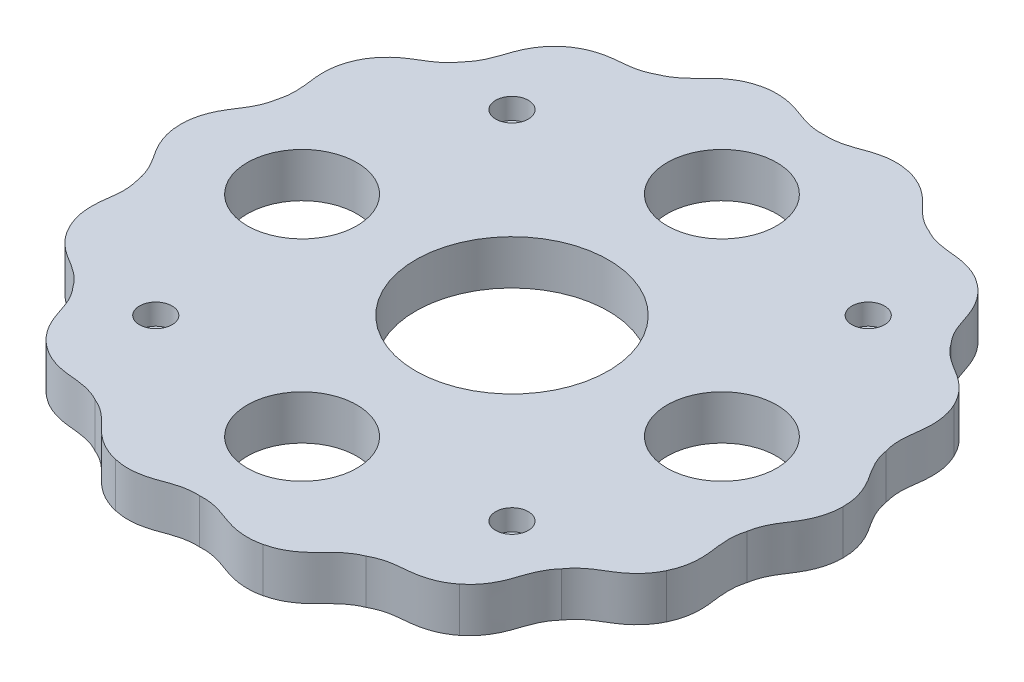
from build123d import *

# Parameters (mm, degrees)
BOSS_EXTRUDE3_DEPTH = 4.7625
SKETCH2_R           = 10.328125
SKETCH2_R_2         = 5.875
CUT_EXTRUDE1_DEPTH  = 4.7625
SKETCH2_4_R         = 1.75
CUT_EXTRUDE2_DEPTH  = 2.245833333


with BuildPart() as part:
    # Sketch1 → Boss-Extrude3 (new body)
    with BuildSketch(Plane(origin=(0, 0, 0), x_dir=(1, 0, 0), z_dir=(0, 1, 0))):
        with BuildLine():
            Line((35.500002326, 0.003735881), (35.500002326, 0))
            Line((35.500002326, 0), (35.500002326, -0.003735881))
            add(Edge.make_bspline(
                [(32.644810899, -7.45096506), (32.674793712, -7.260710929), (32.757965618, -6.873262555), (32.975088878, -6.197475635), (33.30681421, -5.487322542), (33.693887271, -4.83935734), (34.139372051, -4.165162167), (34.499748971, -3.6014921), (34.870711868, -2.889611748), (35.149566879, -2.192738575), (35.418263863, -1.23361479), (35.50061524, -0.495919336), (35.500002326, -0.003735881)],
                knots=[0.02301065, 0.02301065, 0.02301065, 0.02301065, 0.053541567, 0.084072485, 0.145134319, 0.206196153, 0.267257988, 0.389381656, 0.511505325, 0.633628994, 0.755752663, 1, 1, 1, 1], degree=3))
            add(Edge.make_bspline(
                [(31.986017844, -15.399507835), (32.200120458, -14.956331799), (32.445998494, -14.255960238), (32.62005909, -13.275236314), (32.671181344, -12.526384626), (32.645828632, -11.724047822), (32.565707523, -11.059836954), (32.456861927, -10.25911949), (32.389262714, -9.507378309), (32.398512397, -8.723622254), (32.496104055, -8.020553026), (32.589276306, -7.635387164), (32.644810899, -7.45096506)],
                knots=[0.02301065, 0.02301065, 0.02301065, 0.02301065, 0.267257988, 0.389381656, 0.511505325, 0.633628994, 0.755752663, 0.816814497, 0.877876331, 0.938938166, 0.969469083, 1, 1, 1, 1], degree=3))
            Line((31.986017844, -15.399507835), (31.984396906, -15.402873748))
            Line((31.984396906, -15.402873748), (31.982775968, -15.406239661))
            add(Edge.make_bspline(
                [(26.179105738, -20.877140171), (26.288667493, -20.718736177), (26.531710341, -20.405744191), (27.020544594, -19.891087467), (27.62754267, -19.395191866), (28.257425012, -18.979340099), (28.951315253, -18.565199839), (29.520570914, -18.213712342), (30.163670245, -17.733285076), (30.717271866, -17.226414698), (31.375507699, -16.478857279), (31.769777787, -15.849947564), (31.982775968, -15.406239661)],
                knots=[0.02301065, 0.02301065, 0.02301065, 0.02301065, 0.053541567, 0.084072485, 0.145134319, 0.206196153, 0.267257988, 0.389381656, 0.511505325, 0.633628994, 0.755752663, 1, 1, 1, 1], degree=3))
            add(Edge.make_bspline(
                [(22.136810246, -27.752690162), (22.521996911, -27.446297993), (23.047405198, -26.921967502), (23.62974854, -26.113887841), (24.00072267, -25.461376898), (24.326001557, -24.727496287), (24.542005228, -24.094299727), (24.791357022, -23.325651886), (25.05662051, -22.619026286), (25.405013194, -21.916899767), (25.797990545, -21.325799714), (26.049053047, -21.019203188), (26.179105738, -20.877140171)],
                knots=[0.02301065, 0.02301065, 0.02301065, 0.02301065, 0.267257988, 0.389381656, 0.511505325, 0.633628994, 0.755752663, 0.816814497, 0.877876331, 0.938938166, 0.969469083, 1, 1, 1, 1], degree=3))
            Line((22.136810246, -27.752690162), (22.133889416, -27.755019446))
            Line((22.133889416, -27.755019446), (22.130968587, -27.75734873))
            add(Edge.make_bspline(
                [(14.52830762, -30.168341629), (14.695748267, -30.073161626), (15.05052444, -29.89661793), (15.714250068, -29.645025478), (16.476297475, -29.461605575), (17.224233175, -29.360231784), (18.029095404, -29.288171996), (18.694481743, -29.218483478), (19.482343797, -29.064663811), (20.201044438, -28.848188121), (21.118447439, -28.460259983), (21.746546212, -28.06469929), (22.130968587, -27.75734873)],
                knots=[0.02301065, 0.02301065, 0.02301065, 0.02301065, 0.053541567, 0.084072485, 0.145134319, 0.206196153, 0.267257988, 0.389381656, 0.511505325, 0.633628994, 0.755752663, 1, 1, 1, 1], degree=3))
            add(Edge.make_bspline(
                [(7.903135888, -34.609111839), (8.383115662, -34.500188263), (9.083990645, -34.255748926), (9.959276491, -33.780363616), (10.576626521, -33.353431213), (11.188111536, -32.833360849), (11.657457809, -32.356590942), (12.215619812, -31.772252855), (12.761207314, -31.250698702), (13.379739556, -30.769266488), (13.990268616, -30.407210225), (14.349495361, -30.239908237), (14.52830762, -30.168341629)],
                knots=[0.02301065, 0.02301065, 0.02301065, 0.02301065, 0.267257988, 0.389381656, 0.511505325, 0.633628994, 0.755752663, 0.816814497, 0.877876331, 0.938938166, 0.969469083, 1, 1, 1, 1], degree=3))
            Line((7.903135888, -34.609111839), (7.899493673, -34.60994315))
            Line((7.899493673, -34.60994315), (7.895851458, -34.610774462))
            add(Edge.make_bspline(
                [(0, -33.484333037), (0.192155866, -33.471228592), (0.588397592, -33.466099831), (1.295555593, -33.527402621), (2.061719496, -33.692786976), (2.779570716, -33.925969485), (3.535992098, -34.210262493), (4.165721189, -34.43617562), (4.942300224, -34.639429423), (5.683752409, -34.756224087), (6.678619663, -34.804759157), (7.416144457, -34.72089313), (7.895851458, -34.610774462)],
                knots=[0.02301065, 0.02301065, 0.02301065, 0.02301065, 0.053541567, 0.084072485, 0.145134319, 0.206196153, 0.267257988, 0.389381656, 0.511505325, 0.633628994, 0.755752663, 1, 1, 1, 1], degree=3))
            add(Edge.make_bspline(
                [(-7.895851458, -34.610774462), (-7.416144457, -34.72089313), (-6.678619663, -34.804759157), (-5.683752409, -34.756224087), (-4.942300224, -34.639429423), (-4.165721189, -34.43617562), (-3.535992098, -34.210262493), (-2.779570716, -33.925969485), (-2.061719496, -33.692786976), (-1.295555593, -33.527402621), (-0.588397592, -33.466099831), (-0.192155866, -33.471228592), (0, -33.484333037)],
                knots=[0.02301065, 0.02301065, 0.02301065, 0.02301065, 0.267257988, 0.389381656, 0.511505325, 0.633628994, 0.755752663, 0.816814497, 0.877876331, 0.938938166, 0.969469083, 1, 1, 1, 1], degree=3))
            Line((-7.895851458, -34.610774462), (-7.899493673, -34.60994315))
            Line((-7.899493673, -34.60994315), (-7.903135888, -34.609111839))
            add(Edge.make_bspline(
                [(-14.52830762, -30.168341629), (-14.349495361, -30.239908237), (-13.990268616, -30.407210225), (-13.379739556, -30.769266488), (-12.761207314, -31.250698702), (-12.215619812, -31.772252855), (-11.657457809, -32.356590942), (-11.188111536, -32.833360849), (-10.576626521, -33.353431213), (-9.959276491, -33.780363616), (-9.083990645, -34.255748926), (-8.383115662, -34.500188263), (-7.903135888, -34.609111839)],
                knots=[0.02301065, 0.02301065, 0.02301065, 0.02301065, 0.053541567, 0.084072485, 0.145134319, 0.206196153, 0.267257988, 0.389381656, 0.511505325, 0.633628994, 0.755752663, 1, 1, 1, 1], degree=3))
            add(Edge.make_bspline(
                [(-22.130968587, -27.75734873), (-21.746546212, -28.06469929), (-21.118447439, -28.460259983), (-20.201044438, -28.848188121), (-19.482343797, -29.064663811), (-18.694481743, -29.218483478), (-18.029095404, -29.288171996), (-17.224233175, -29.360231784), (-16.476297475, -29.461605575), (-15.714250068, -29.645025478), (-15.05052444, -29.89661793), (-14.695748267, -30.073161626), (-14.52830762, -30.168341629)],
                knots=[0.02301065, 0.02301065, 0.02301065, 0.02301065, 0.267257988, 0.389381656, 0.511505325, 0.633628994, 0.755752663, 0.816814497, 0.877876331, 0.938938166, 0.969469083, 1, 1, 1, 1], degree=3))
            Line((-22.130968587, -27.75734873), (-22.133889416, -27.755019446))
            Line((-22.133889416, -27.755019446), (-22.136810246, -27.752690162))
            add(Edge.make_bspline(
                [(-26.179105738, -20.877140171), (-26.049053047, -21.019203188), (-25.797990545, -21.325799714), (-25.405013194, -21.916899767), (-25.05662051, -22.619026286), (-24.791357022, -23.325651886), (-24.542005228, -24.094299727), (-24.326001557, -24.727496287), (-24.00072267, -25.461376898), (-23.62974854, -26.113887841), (-23.047405198, -26.921967502), (-22.521996911, -27.446297993), (-22.136810246, -27.752690162)],
                knots=[0.02301065, 0.02301065, 0.02301065, 0.02301065, 0.053541567, 0.084072485, 0.145134319, 0.206196153, 0.267257988, 0.389381656, 0.511505325, 0.633628994, 0.755752663, 1, 1, 1, 1], degree=3))
            add(Edge.make_bspline(
                [(-31.982775968, -15.406239661), (-31.769777787, -15.849947564), (-31.375507698, -16.478857279), (-30.717271866, -17.226414698), (-30.163670245, -17.733285076), (-29.520570914, -18.213712342), (-28.951315253, -18.565199839), (-28.257425012, -18.979340099), (-27.62754267, -19.395191866), (-27.020544594, -19.891087467), (-26.531710341, -20.405744191), (-26.288667493, -20.718736177), (-26.179105738, -20.877140171)],
                knots=[0.02301065, 0.02301065, 0.02301065, 0.02301065, 0.267257988, 0.389381656, 0.511505325, 0.633628994, 0.755752663, 0.816814497, 0.877876331, 0.938938166, 0.969469083, 1, 1, 1, 1], degree=3))
            Line((-31.982775968, -15.406239661), (-31.984396906, -15.402873748))
            Line((-31.984396906, -15.402873748), (-31.986017844, -15.399507835))
            add(Edge.make_bspline(
                [(-32.644810899, -7.45096506), (-32.589276306, -7.635387164), (-32.496104055, -8.020553026), (-32.398512397, -8.723622254), (-32.389262714, -9.507378309), (-32.456861927, -10.25911949), (-32.565707523, -11.059836954), (-32.645828632, -11.724047822), (-32.671181344, -12.526384626), (-32.62005909, -13.275236314), (-32.445998494, -14.255960238), (-32.200120458, -14.956331799), (-31.986017844, -15.399507835)],
                knots=[0.02301065, 0.02301065, 0.02301065, 0.02301065, 0.053541567, 0.084072485, 0.145134319, 0.206196153, 0.267257988, 0.389381656, 0.511505325, 0.633628994, 0.755752663, 1, 1, 1, 1], degree=3))
            add(Edge.make_bspline(
                [(-35.500002326, -0.003735881), (-35.50061524, -0.495919336), (-35.418263863, -1.23361479), (-35.149566879, -2.192738575), (-34.870711868, -2.889611748), (-34.499748971, -3.6014921), (-34.139372051, -4.165162167), (-33.693887271, -4.83935734), (-33.30681421, -5.487322542), (-32.975088878, -6.197475635), (-32.757965618, -6.873262555), (-32.674793712, -7.260710929), (-32.644810899, -7.45096506)],
                knots=[0.02301065, 0.02301065, 0.02301065, 0.02301065, 0.267257988, 0.389381656, 0.511505325, 0.633628994, 0.755752663, 0.816814497, 0.877876331, 0.938938166, 0.969469083, 1, 1, 1, 1], degree=3))
            Line((-35.500002326, -0.003735881), (-35.500002326, 0))
            Line((-35.500002326, 0), (-35.500002326, 0.003735881))
            add(Edge.make_bspline(
                [(-32.644810899, 7.45096506), (-32.674793712, 7.260710929), (-32.757965618, 6.873262555), (-32.975088878, 6.197475635), (-33.30681421, 5.487322542), (-33.693887271, 4.83935734), (-34.139372051, 4.165162167), (-34.499748971, 3.6014921), (-34.870711868, 2.889611748), (-35.149566879, 2.192738575), (-35.418263863, 1.23361479), (-35.50061524, 0.495919336), (-35.500002326, 0.003735881)],
                knots=[0.02301065, 0.02301065, 0.02301065, 0.02301065, 0.053541567, 0.084072485, 0.145134319, 0.206196153, 0.267257988, 0.389381656, 0.511505325, 0.633628994, 0.755752663, 1, 1, 1, 1], degree=3))
            add(Edge.make_bspline(
                [(-31.986017844, 15.399507835), (-32.200120458, 14.956331799), (-32.445998494, 14.255960238), (-32.62005909, 13.275236314), (-32.671181344, 12.526384626), (-32.645828632, 11.724047822), (-32.565707523, 11.059836954), (-32.456861927, 10.25911949), (-32.389262714, 9.507378309), (-32.398512397, 8.723622254), (-32.496104055, 8.020553026), (-32.589276306, 7.635387164), (-32.644810899, 7.45096506)],
                knots=[0.02301065, 0.02301065, 0.02301065, 0.02301065, 0.267257988, 0.389381656, 0.511505325, 0.633628994, 0.755752663, 0.816814497, 0.877876331, 0.938938166, 0.969469083, 1, 1, 1, 1], degree=3))
            Line((-31.986017844, 15.399507835), (-31.984396906, 15.402873748))
            Line((-31.984396906, 15.402873748), (-31.982775968, 15.406239661))
            add(Edge.make_bspline(
                [(-26.179105738, 20.877140171), (-26.288667493, 20.718736177), (-26.531710341, 20.405744191), (-27.020544594, 19.891087467), (-27.62754267, 19.395191866), (-28.257425012, 18.979340099), (-28.951315253, 18.565199839), (-29.520570914, 18.213712342), (-30.163670245, 17.733285076), (-30.717271866, 17.226414698), (-31.375507699, 16.478857278), (-31.769777787, 15.849947564), (-31.982775968, 15.406239661)],
                knots=[0.02301065, 0.02301065, 0.02301065, 0.02301065, 0.053541567, 0.084072485, 0.145134319, 0.206196153, 0.267257988, 0.389381656, 0.511505325, 0.633628994, 0.755752663, 1, 1, 1, 1], degree=3))
            add(Edge.make_bspline(
                [(-22.136810246, 27.752690162), (-22.521996911, 27.446297993), (-23.047405198, 26.921967502), (-23.62974854, 26.113887841), (-24.00072267, 25.461376898), (-24.326001557, 24.727496287), (-24.542005228, 24.094299727), (-24.791357022, 23.325651886), (-25.05662051, 22.619026286), (-25.405013194, 21.916899767), (-25.797990545, 21.325799714), (-26.049053047, 21.019203188), (-26.179105738, 20.877140171)],
                knots=[0.02301065, 0.02301065, 0.02301065, 0.02301065, 0.267257988, 0.389381656, 0.511505325, 0.633628994, 0.755752663, 0.816814497, 0.877876331, 0.938938166, 0.969469083, 1, 1, 1, 1], degree=3))
            Line((-22.136810246, 27.752690162), (-22.133889416, 27.755019446))
            Line((-22.133889416, 27.755019446), (-22.130968587, 27.75734873))
            add(Edge.make_bspline(
                [(-14.52830762, 30.168341629), (-14.695748267, 30.073161626), (-15.05052444, 29.89661793), (-15.714250068, 29.645025478), (-16.476297475, 29.461605575), (-17.224233175, 29.360231784), (-18.029095404, 29.288171996), (-18.694481743, 29.218483478), (-19.482343797, 29.064663811), (-20.201044438, 28.848188121), (-21.118447439, 28.460259983), (-21.746546212, 28.06469929), (-22.130968587, 27.75734873)],
                knots=[0.02301065, 0.02301065, 0.02301065, 0.02301065, 0.053541567, 0.084072485, 0.145134319, 0.206196153, 0.267257988, 0.389381656, 0.511505325, 0.633628994, 0.755752663, 1, 1, 1, 1], degree=3))
            add(Edge.make_bspline(
                [(-7.903135888, 34.609111839), (-8.383115662, 34.500188263), (-9.083990645, 34.255748926), (-9.959276491, 33.780363616), (-10.576626521, 33.353431213), (-11.188111536, 32.833360849), (-11.657457809, 32.356590942), (-12.215619812, 31.772252855), (-12.761207314, 31.250698702), (-13.379739556, 30.769266488), (-13.990268616, 30.407210225), (-14.349495361, 30.239908237), (-14.52830762, 30.168341629)],
                knots=[0.02301065, 0.02301065, 0.02301065, 0.02301065, 0.267257988, 0.389381656, 0.511505325, 0.633628994, 0.755752663, 0.816814497, 0.877876331, 0.938938166, 0.969469083, 1, 1, 1, 1], degree=3))
            Line((-7.903135888, 34.609111839), (-7.899493673, 34.60994315))
            Line((-7.899493673, 34.60994315), (-7.895851458, 34.610774462))
            add(Edge.make_bspline(
                [(0, 33.484333037), (-0.192155866, 33.471228592), (-0.588397592, 33.466099831), (-1.295555593, 33.527402621), (-2.061719496, 33.692786976), (-2.779570716, 33.925969485), (-3.535992098, 34.210262493), (-4.165721189, 34.43617562), (-4.942300224, 34.639429423), (-5.683752409, 34.756224087), (-6.678619663, 34.804759157), (-7.416144457, 34.72089313), (-7.895851458, 34.610774462)],
                knots=[0.02301065, 0.02301065, 0.02301065, 0.02301065, 0.053541567, 0.084072485, 0.145134319, 0.206196153, 0.267257988, 0.389381656, 0.511505325, 0.633628994, 0.755752663, 1, 1, 1, 1], degree=3))
            add(Edge.make_bspline(
                [(7.895851458, 34.610774462), (7.416144457, 34.72089313), (6.678619663, 34.804759157), (5.683752409, 34.756224087), (4.942300224, 34.639429423), (4.165721189, 34.43617562), (3.535992098, 34.210262493), (2.779570716, 33.925969485), (2.061719496, 33.692786976), (1.295555593, 33.527402621), (0.588397592, 33.466099831), (0.192155866, 33.471228592), (0, 33.484333037)],
                knots=[0.02301065, 0.02301065, 0.02301065, 0.02301065, 0.267257988, 0.389381656, 0.511505325, 0.633628994, 0.755752663, 0.816814497, 0.877876331, 0.938938166, 0.969469083, 1, 1, 1, 1], degree=3))
            Line((7.895851458, 34.610774462), (7.899493673, 34.60994315))
            Line((7.899493673, 34.60994315), (7.903135888, 34.609111839))
            add(Edge.make_bspline(
                [(14.52830762, 30.168341629), (14.349495361, 30.239908237), (13.990268616, 30.407210225), (13.379739556, 30.769266488), (12.761207314, 31.250698702), (12.215619812, 31.772252855), (11.657457809, 32.356590942), (11.188111536, 32.833360849), (10.576626521, 33.353431213), (9.959276491, 33.780363616), (9.083990645, 34.255748926), (8.383115662, 34.500188263), (7.903135888, 34.609111839)],
                knots=[0.02301065, 0.02301065, 0.02301065, 0.02301065, 0.053541567, 0.084072485, 0.145134319, 0.206196153, 0.267257988, 0.389381656, 0.511505325, 0.633628994, 0.755752663, 1, 1, 1, 1], degree=3))
            add(Edge.make_bspline(
                [(22.130968587, 27.75734873), (21.746546212, 28.06469929), (21.118447439, 28.460259983), (20.201044438, 28.848188121), (19.482343797, 29.064663811), (18.694481743, 29.218483478), (18.029095404, 29.288171996), (17.224233175, 29.360231784), (16.476297475, 29.461605575), (15.714250068, 29.645025478), (15.05052444, 29.89661793), (14.695748267, 30.073161626), (14.52830762, 30.168341629)],
                knots=[0.02301065, 0.02301065, 0.02301065, 0.02301065, 0.267257988, 0.389381656, 0.511505325, 0.633628994, 0.755752663, 0.816814497, 0.877876331, 0.938938166, 0.969469083, 1, 1, 1, 1], degree=3))
            Line((22.130968587, 27.75734873), (22.133889416, 27.755019446))
            Line((22.133889416, 27.755019446), (22.136810246, 27.752690162))
            add(Edge.make_bspline(
                [(26.179105738, 20.877140171), (26.049053047, 21.019203188), (25.797990545, 21.325799714), (25.405013194, 21.916899767), (25.05662051, 22.619026286), (24.791357022, 23.325651886), (24.542005228, 24.094299727), (24.326001557, 24.727496287), (24.00072267, 25.461376898), (23.62974854, 26.113887841), (23.047405198, 26.921967502), (22.521996911, 27.446297993), (22.136810246, 27.752690162)],
                knots=[0.02301065, 0.02301065, 0.02301065, 0.02301065, 0.053541567, 0.084072485, 0.145134319, 0.206196153, 0.267257988, 0.389381656, 0.511505325, 0.633628994, 0.755752663, 1, 1, 1, 1], degree=3))
            add(Edge.make_bspline(
                [(31.982775968, 15.406239661), (31.769777787, 15.849947564), (31.375507698, 16.478857279), (30.717271866, 17.226414698), (30.163670245, 17.733285076), (29.520570914, 18.213712342), (28.951315253, 18.565199839), (28.257425012, 18.979340099), (27.62754267, 19.395191866), (27.020544594, 19.891087467), (26.531710341, 20.405744191), (26.288667493, 20.718736177), (26.179105738, 20.877140171)],
                knots=[0.02301065, 0.02301065, 0.02301065, 0.02301065, 0.267257988, 0.389381656, 0.511505325, 0.633628994, 0.755752663, 0.816814497, 0.877876331, 0.938938166, 0.969469083, 1, 1, 1, 1], degree=3))
            Line((31.982775968, 15.406239661), (31.984396906, 15.402873748))
            Line((31.984396906, 15.402873748), (31.986017844, 15.399507835))
            add(Edge.make_bspline(
                [(32.644810899, 7.45096506), (32.589276306, 7.635387164), (32.496104055, 8.020553026), (32.398512397, 8.723622254), (32.389262714, 9.507378309), (32.456861927, 10.25911949), (32.565707523, 11.059836954), (32.645828632, 11.724047822), (32.671181344, 12.526384626), (32.62005909, 13.275236314), (32.445998494, 14.255960238), (32.200120458, 14.956331799), (31.986017844, 15.399507835)],
                knots=[0.02301065, 0.02301065, 0.02301065, 0.02301065, 0.053541567, 0.084072485, 0.145134319, 0.206196153, 0.267257988, 0.389381656, 0.511505325, 0.633628994, 0.755752663, 1, 1, 1, 1], degree=3))
            add(Edge.make_bspline(
                [(35.500002326, 0.003735881), (35.50061524, 0.495919336), (35.418263863, 1.23361479), (35.149566879, 2.192738575), (34.870711868, 2.889611748), (34.499748971, 3.6014921), (34.139372051, 4.165162167), (33.693887271, 4.83935734), (33.30681421, 5.487322542), (32.975088878, 6.197475635), (32.757965618, 6.873262555), (32.674793712, 7.260710929), (32.644810899, 7.45096506)],
                knots=[0.02301065, 0.02301065, 0.02301065, 0.02301065, 0.267257988, 0.389381656, 0.511505325, 0.633628994, 0.755752663, 0.816814497, 0.877876331, 0.938938166, 0.969469083, 1, 1, 1, 1], degree=3))
        make_face()
    extrude(amount=BOSS_EXTRUDE3_DEPTH)

    # Sketch2 → Cut-Extrude1 (cut)
    with BuildSketch(Plane(origin=(0, 4.7625, 0), x_dir=(1, 0, 0), z_dir=(0, 1, 0))):
        Circle(SKETCH2_R)
        with Locations((22.5, 0)):
            Circle(SKETCH2_R_2)
        with Locations((0, -22.5)):
            Circle(SKETCH2_R_2)
        with Locations((-22.5, 0)):
            Circle(SKETCH2_R_2)
        with Locations((0, 22.5)):
            Circle(SKETCH2_R_2)
    extrude(amount=-CUT_EXTRUDE1_DEPTH, mode=Mode.SUBTRACT)

    # Sketch2<4> → Cut-Extrude2 (cut)
    with BuildSketch(Plane(origin=(0, 4.7625, 0), x_dir=(1, 0, 0), z_dir=(0, 1, 0))):
        with Locations((19.091883092, 19.091883092)):
            Circle(SKETCH2_4_R)
        with Locations((19.091883092, -19.091883092)):
            Circle(SKETCH2_4_R)
        with Locations((-19.091883092, -19.091883092)):
            Circle(SKETCH2_4_R)
        with Locations((-19.091883092, 19.091883092)):
            Circle(SKETCH2_4_R)
    extrude(amount=-CUT_EXTRUDE2_DEPTH, mode=Mode.SUBTRACT)


solid = part.part
